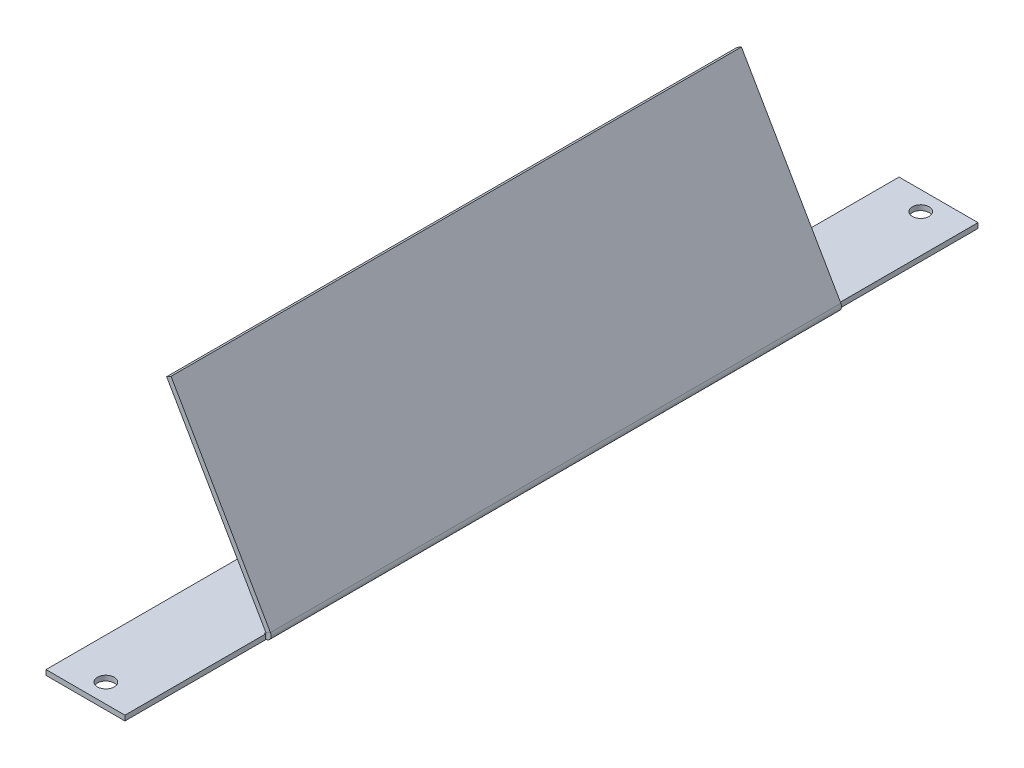
from build123d import *

# Parameters (mm, degrees)
SKIZZE2_W                       = 350
SKIZZE2_H                       = 335
BASIS_BLECH1_DEPTH              = 2
KANTE_LASCHE1_STRIP_CUT_DEPTH   = 224
KANTE_LASCHE1_RELIEF_W          = 14.502816622
KANTE_LASCHE1_RELIEF_H          = 0.3
KANTE_LASCHE1_RELIEF_CUT_DEPTH  = 2
KANTE_LASCHE1_DEPTH             = 224
DURCHGANGSLOCH_F_R_M61_D        = 6.6
DURCHGANGSLOCH_F_R_M61_DEPTH    = 15
DURCHGANGSLOCH_F_R_M61_TIP      = 1.982840043
DURCHGANGSLOCH_F_R_M121_D       = 13.5
SKIZZE30_W                      = 319
SKIZZE30_H                      = 335
SCHNITT_LINEAR_AUSTRAGEN1_DEPTH = 10


# Sheet-metal steps are written as plain solids
with BuildPart() as part:
    # Skizze2 → Basis-Blech1 (new body)
    with BuildSketch(Plane(origin=(0, 0, 0), x_dir=(1, 0, 0), z_dir=(0, 1, 0))):
        Rectangle(SKIZZE2_W, SKIZZE2_H)
    extrude(amount=-BASIS_BLECH1_DEPTH)

    # Kante-Lasche1 strip (across the edge) → Kante-Lasche1 strip cut (cut)
    with BuildSketch(Plane(origin=(175, 0, 112), x_dir=(-0.8660254037844407, -0.49999999999999645, 0), z_dir=(0, 0, -1))):
        Polygon((-11.15, -8.746856578), (1.15, -1.645448267), (0.15, 0.08660254), (-12.15, -7.014805771), align=None)
    extrude(amount=KANTE_LASCHE1_STRIP_CUT_DEPTH, mode=Mode.SUBTRACT)

    # Kante-Lasche1 relief (on the sheet) → Kante-Lasche1 relief cut (cut)
    with BuildSketch(Plane(origin=(174.826794919, 0, 112), x_dir=(-1, 0, 0), z_dir=(0, 1, 0))):
        with Locations((-6.951408311, 0.15)):
            Rectangle(KANTE_LASCHE1_RELIEF_W, KANTE_LASCHE1_RELIEF_H)
        with Locations((-6.951408311, -224.15)):
            Rectangle(KANTE_LASCHE1_RELIEF_W, KANTE_LASCHE1_RELIEF_H)
    extrude(amount=-KANTE_LASCHE1_RELIEF_CUT_DEPTH, mode=Mode.SUBTRACT)

    # Kante-Lasche1 section (across the edge) → Kante-Lasche1 (add)
    with BuildSketch(Plane(origin=(175, 0, 112), x_dir=(-0.8660254037844407, -0.49999999999999645, 0), z_dir=(0, 0, -1))):
        with BuildLine():
            Line((-2, 0.173205081), (-2, 78.267949192))
            Line((-2, 78.267949192), (0, 78.267949192))
            Line((0, 78.267949192), (0, 0.173205081))
            ThreePointArc((0, 0.173205081), (0.05, 0.08660254), (0.15, 0.08660254))
            Line((0.15, 0.08660254), (1.15, -1.645448267))
            ThreePointArc((1.15, -1.645448267), (-0.95, -1.645448267), (-2, 0.173205081))
        make_face()
    extrude(amount=KANTE_LASCHE1_DEPTH)

    # Durchgangsloch für M61
    with Locations(Plane(origin=(0, -2, 0), x_dir=(-1, 0, 0), z_dir=(0, -1, 0))):
        with Locations((-160, -160), (160, -160), (160, 160), (-160, 160)):
            Hole(DURCHGANGSLOCH_F_R_M61_D / 2, depth=DURCHGANGSLOCH_F_R_M61_DEPTH)
            with Locations((0, 0, -(DURCHGANGSLOCH_F_R_M61_DEPTH + DURCHGANGSLOCH_F_R_M61_TIP / 2))):  # 118° drill point
                Cone(0, DURCHGANGSLOCH_F_R_M61_D / 2, DURCHGANGSLOCH_F_R_M61_TIP, mode=Mode.SUBTRACT)

    # Durchgangsloch für M121 (through all)
    with Locations(Plane(origin=(0, 0, 0), x_dir=(1, 0, 0), z_dir=(0, 1, 0))):
        with Locations((-25, 145.5), (-25, -145.5)):
            Hole(DURCHGANGSLOCH_F_R_M121_D / 2)

    # Skizze30 → Schnitt-Linear austragen1 (cut)
    with BuildSketch(Plane.XZ.offset(2)):
        with Locations((-15.5, 0)):
            Rectangle(SKIZZE30_W, SKIZZE30_H)
    extrude(amount=-SCHNITT_LINEAR_AUSTRAGEN1_DEPTH, mode=Mode.SUBTRACT)


solid = part.part
